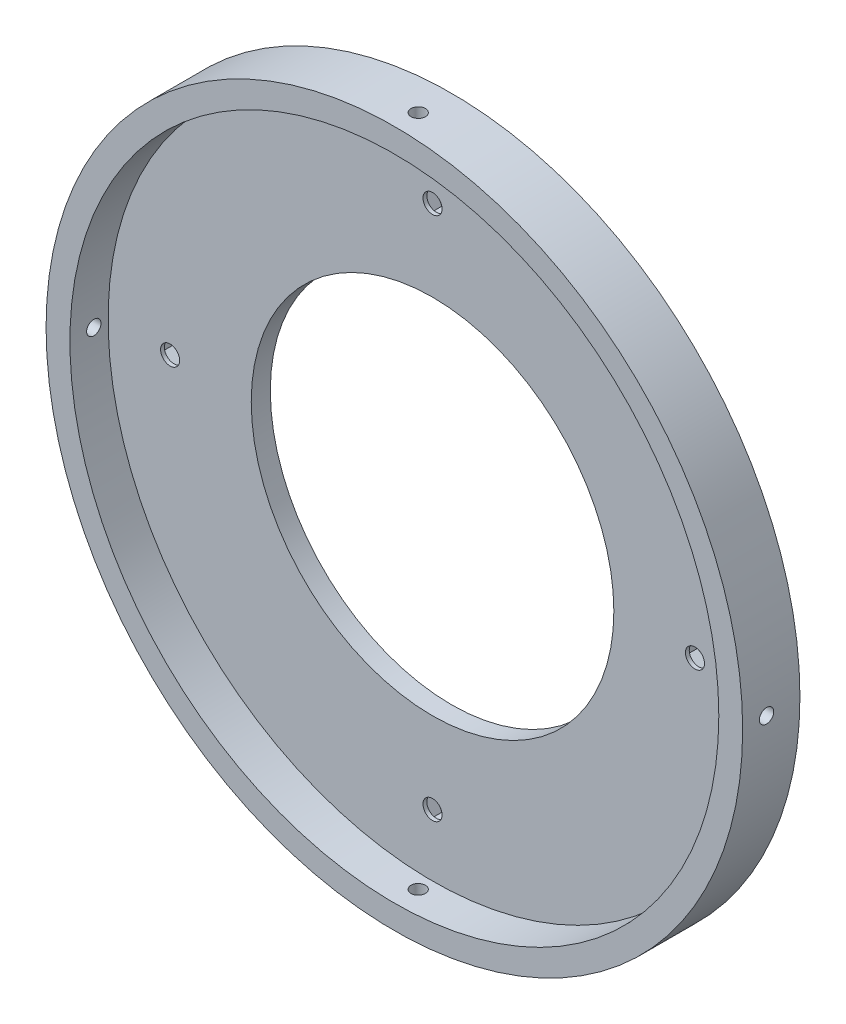
from build123d import *

# Parameters (mm, degrees)
SKETCH1_R               = 73
SKETCH1_R_2             = 38
BOSS_EXTRUDE1_DEPTH     = 4
SKETCH2_R               = 73
SKETCH2_R_2             = 68
BOSS_EXTRUDE2_DEPTH     = 8
CUT_EXTRUDE1_REACH      = 105.933
CUT_EXTRUDE1_END_RADIUS = 73
SKETCH3_R               = 1.5
CIRPATTERN1_COUNT       = 4
F_4_0MM_DOWEL_HOLE1_D   = 4
CUT_EXTRUDE2_DEPTH      = 3.2


with BuildPart() as part:
    # Sketch1 → Boss-Extrude1 (new body)
    with BuildSketch(Plane.XY):
        Circle(SKETCH1_R)
        Circle(SKETCH1_R_2, mode=Mode.SUBTRACT)
    extrude(amount=BOSS_EXTRUDE1_DEPTH)

    # Sketch2 → Boss-Extrude2 (add)
    with BuildSketch(Plane.XY.offset(4)):
        Circle(SKETCH2_R)
        Circle(SKETCH2_R_2, mode=Mode.SUBTRACT)
    extrude(amount=BOSS_EXTRUDE2_DEPTH)

    # Cut-Extrude1: up to this cylinder (the profile starts inside it)
    cut_extrude1_end = Plane(origin=(0, 0, 7), z_dir=(0, 0, -1)) * Cylinder(CUT_EXTRUDE1_END_RADIUS, 358.866, mode=Mode.PRIVATE)
    # Sketch3 → Cut-Extrude1 (cut, up to the surface)
    with BuildSketch(Plane(origin=(0, 0, 0), x_dir=(1, 0, 0), z_dir=(0, 1, 0)), mode=Mode.PRIVATE) as cut_extrude1_sk1:
        with Locations((0, -7)):
            Circle(SKETCH3_R)
    cut_extrude1_tool1 = extrude(cut_extrude1_sk1.sketch, amount=-CUT_EXTRUDE1_REACH, mode=Mode.PRIVATE) & cut_extrude1_end
    cut_extrude1 = cut_extrude1_tool1.solids().sort_by_distance((0, 0, 7))[0]
    add(cut_extrude1, mode=Mode.SUBTRACT)

    # CirPattern1: Cut-Extrude1 ×4 about axis
    cirpattern1_axis = Axis((0, 0, 4), (0, 0, -1))
    for i in range(1, CIRPATTERN1_COUNT):
        add(cut_extrude1.rotate(cirpattern1_axis, i * 360 / CIRPATTERN1_COUNT), mode=Mode.SUBTRACT)

    # Ø4.0mm Dowel Hole1 (through all)
    with Locations(Plane(origin=(0, 0, 0), x_dir=(-1, 0, 0), z_dir=(0, 0, -1))):
        with Locations((0, 55), (55, 0), (0, -55), (-55, 0)):
            Hole(F_4_0MM_DOWEL_HOLE1_D / 2)

    # Sketch13 → Cut-Extrude2 (cut)
    with BuildSketch(Plane(origin=(0, 0, 0), x_dir=(-1, 0, 0), z_dir=(0, 0, -1))):
        Polygon((4.041451884, 55), (2.020725942, 58.5), (-2.020725942, 58.5), (-4.041451884, 55), (-2.020725942, 51.5), (2.020725942, 51.5), align=None)
        Polygon((55, -4.041451884), (58.5, -2.020725942), (58.5, 2.020725942), (55, 4.041451884), (51.5, 2.020725942), (51.5, -2.020725942), align=None)
        Polygon((-4.041451884, -55), (-2.020725942, -58.5), (2.020725942, -58.5), (4.041451884, -55), (2.020725942, -51.5), (-2.020725942, -51.5), align=None)
        Polygon((-55, 4.041451884), (-58.5, 2.020725942), (-58.5, -2.020725942), (-55, -4.041451884), (-51.5, -2.020725942), (-51.5, 2.020725942), align=None)
    extrude(amount=-CUT_EXTRUDE2_DEPTH, mode=Mode.SUBTRACT)


solid = part.part
